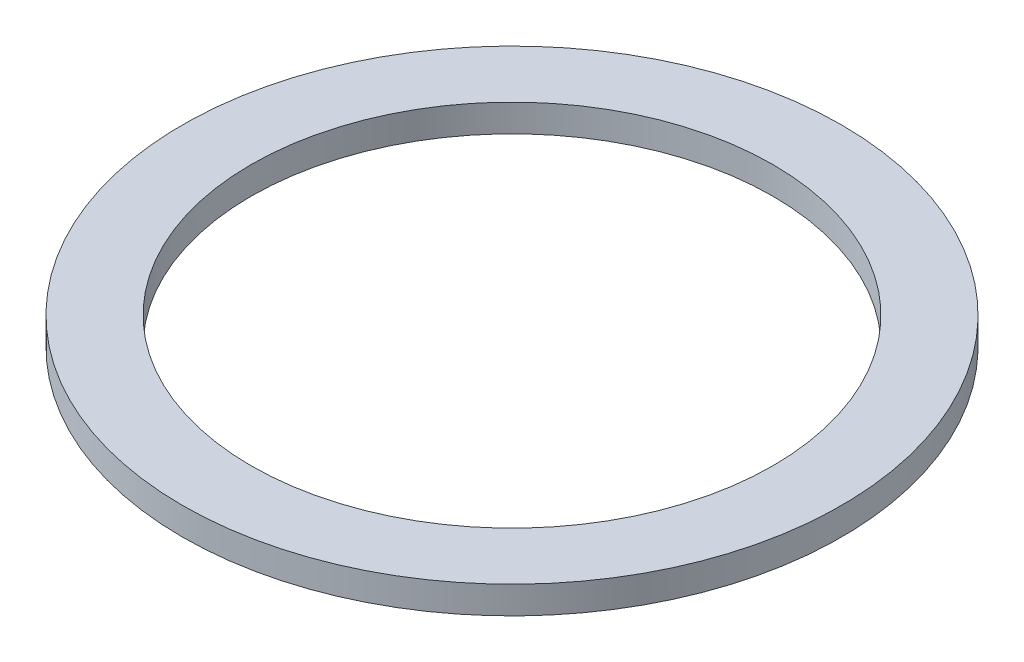
from build123d import *

# Parameters (mm, degrees)
SKETCH1_R           = 60
BOSS_EXTRUDE1_DEPTH = 5
SKETCH2_R           = 47.5
CUT_EXTRUDE1_DEPTH  = 86


with BuildPart() as part:
    # Sketch1 → Boss-Extrude1 (new body)
    with BuildSketch(Plane(origin=(0, 0, 0), x_dir=(1, 0, 0), z_dir=(0, 1, 0))):
        Circle(SKETCH1_R)
    extrude(amount=BOSS_EXTRUDE1_DEPTH)

    # Sketch2 → Cut-Extrude1 (cut, through all)
    with BuildSketch(Plane(origin=(0, 0, 0), x_dir=(1, 0, 0), z_dir=(0, 1, 0))):
        Circle(SKETCH2_R)
    extrude(amount=CUT_EXTRUDE1_DEPTH, mode=Mode.SUBTRACT)


solid = part.part
